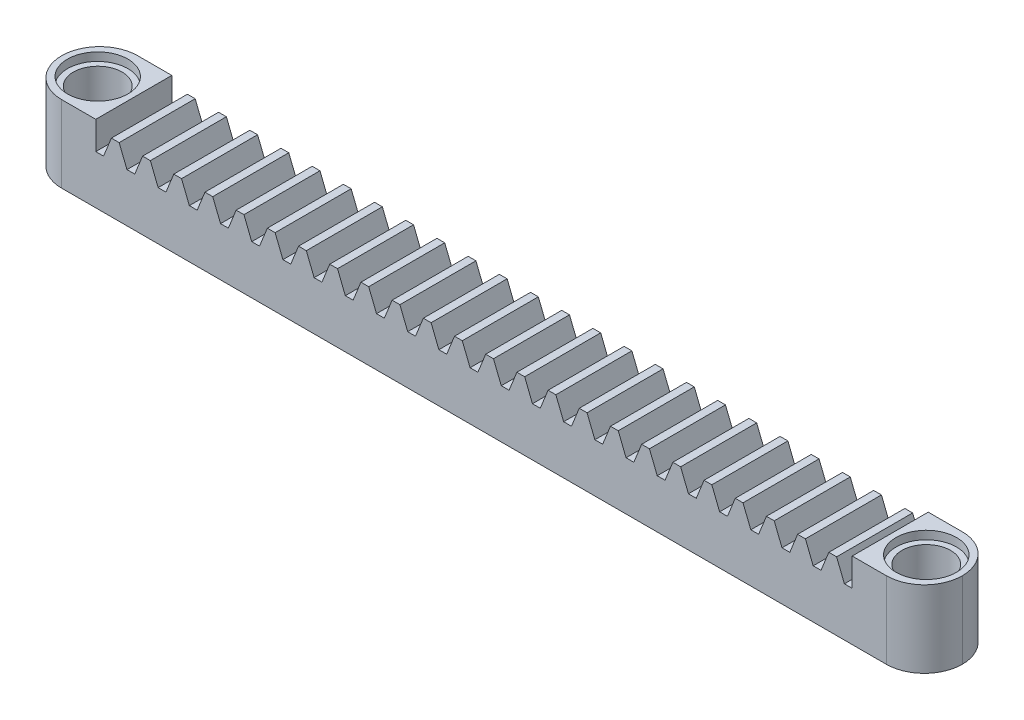
from build123d import *

# Parameters (mm, degrees)
SALIENTE_EXTRUIR1_DEPTH = 7.8
MATRIZL1_DEPTH          = 7.8
CROQUIS2_W              = 7.8
CROQUIS2_H              = 4.999
SALIENTE_EXTRUIR2_DEPTH = 0.801
CROQUIS4_W              = 7.4
CROQUIS4_H              = 7.8
CROQUIS4_R              = 3.1
SALIENTE_EXTRUIR3_DEPTH = 7.87
SALIENTE_EXTRUIR4_START = 0.85
CROQUIS4_3_R            = 3.1
CROQUIS4_3_R_2          = 2.5
SALIENTE_EXTRUIR4_DEPTH = 6.17
REDONDEO2_R             = 3.9


with BuildPart() as part:
    # Croquis1 → Saliente-Extruir1 (new body)
    with BuildSketch(Plane.XY):
        Polygon((0, 0), (3.199966839, 0), (3.199966839, 4.999), (2.398966839, 4.999), (1.598983419, 6.999), (0.799983419, 6.999), (0, 4.999), align=None)
    extrude(amount=SALIENTE_EXTRUIR1_DEPTH)

    # MatrizL1: read off the stored shape, not the designer's step
    # MatrizL1 outline → MatrizL1 (add)
    with BuildSketch(Plane.XY):
        Polygon((0.799983419, 6.999), (0, 4.999), (0, 0), (76.799966839, 0), (76.799966839, 4.999), (75.998966839, 4.999), (75.198983419, 6.999), (74.399983419, 6.999), (73.6, 4.999), (72.798966839, 4.999), (71.998983419, 6.999), (71.199983419, 6.999), (70.4, 4.999), (69.598966839, 4.999), (68.798983419, 6.999), (67.999983419, 6.999), (67.2, 4.999), (66.398966839, 4.999), (65.598983419, 6.999), (64.799983419, 6.999), (64, 4.999), (63.198966839, 4.999), (62.398983419, 6.999), (61.599983419, 6.999), (60.8, 4.999), (59.998966839, 4.999), (59.198983419, 6.999), (58.399983419, 6.999), (57.6, 4.999), (56.798966839, 4.999), (55.998983419, 6.999), (55.199983419, 6.999), (54.4, 4.999), (53.598966839, 4.999), (52.798983419, 6.999), (51.999983419, 6.999), (51.2, 4.999), (50.398966839, 4.999), (49.598983419, 6.999), (48.799983419, 6.999), (48, 4.999), (47.198966839, 4.999), (46.398983419, 6.999), (45.599983419, 6.999), (44.8, 4.999), (43.998966839, 4.999), (43.198983419, 6.999), (42.399983419, 6.999), (41.6, 4.999), (40.798966839, 4.999), (39.998983419, 6.999), (39.199983419, 6.999), (38.4, 4.999), (37.598966839, 4.999), (36.798983419, 6.999), (35.999983419, 6.999), (35.2, 4.999), (34.398966839, 4.999), (33.598983419, 6.999), (32.799983419, 6.999), (32, 4.999), (31.198966839, 4.999), (30.398983419, 6.999), (29.599983419, 6.999), (28.8, 4.999), (27.998966839, 4.999), (27.198983419, 6.999), (26.399983419, 6.999), (25.6, 4.999), (24.798966839, 4.999), (23.998983419, 6.999), (23.199983419, 6.999), (22.4, 4.999), (21.598966839, 4.999), (20.798983419, 6.999), (19.999983419, 6.999), (19.2, 4.999), (18.398966839, 4.999), (17.598983419, 6.999), (16.799983419, 6.999), (16, 4.999), (15.198966839, 4.999), (14.398983419, 6.999), (13.599983419, 6.999), (12.8, 4.999), (11.998966839, 4.999), (11.198983419, 6.999), (10.399983419, 6.999), (9.6, 4.999), (8.798966839, 4.999), (7.998983419, 6.999), (7.199983419, 6.999), (6.4, 4.999), (5.598966839, 4.999), (4.798983419, 6.999), (3.999983419, 6.999), (3.2, 4.999), (2.398966839, 4.999), (1.598983419, 6.999), align=None)
    extrude(amount=MATRIZL1_DEPTH)

    # Croquis2 → Saliente-Extruir2 (add)
    with BuildSketch(Plane.ZY):
        with Locations((3.9, 2.4995)):
            Rectangle(CROQUIS2_W, CROQUIS2_H)
    extrude(amount=SALIENTE_EXTRUIR2_DEPTH)

    # Croquis4 → Saliente-Extruir3 (add)
    # profile 1 of 2: a face of its own
    with BuildSketch(Plane(origin=(0, 0, 0), x_dir=(1, 0, 0), z_dir=(0, 1, 0))):
        with Locations((-4.501, -3.9)):
            Rectangle(CROQUIS4_W, CROQUIS4_H)
        with Locations(Location((-4.501, -3.9, 0), (0, 0, 270))):
            Circle(CROQUIS4_R, mode=Mode.SUBTRACT)
    # profile 2 of 2: a face of its own
    with BuildSketch(Plane(origin=(0, 0, 0), x_dir=(1, 0, 0), z_dir=(0, 1, 0))):
        with Locations((80.499966839, -3.9)):
            Rectangle(CROQUIS4_W, CROQUIS4_H)
        with Locations(Location((80.499966839, -3.9, 0), (0, 0, 270))):
            Circle(CROQUIS4_R, mode=Mode.SUBTRACT)
    extrude(amount=SALIENTE_EXTRUIR3_DEPTH)

    # Croquis4<3> → Saliente-Extruir4 (add)
    # profile 1 of 2: a face of its own
    with BuildSketch(Plane(origin=(0, 0, 0), x_dir=(1, 0, 0), z_dir=(0, 1, 0)).offset(SALIENTE_EXTRUIR4_START)):
        with Locations(Location((-4.501, -3.9, 0), (0, 0, 270))):
            Circle(CROQUIS4_3_R)
        with Locations(Location((-4.501, -3.9, 0), (0, 0, 270))):
            Circle(CROQUIS4_3_R_2, mode=Mode.SUBTRACT)
    # profile 2 of 2: a face of its own
    with BuildSketch(Plane(origin=(0, 0, 0), x_dir=(1, 0, 0), z_dir=(0, 1, 0)).offset(SALIENTE_EXTRUIR4_START)):
        with Locations(Location((80.499966839, -3.9, 0), (0, 0, 270))):
            Circle(CROQUIS4_3_R)
        with Locations(Location((80.499966839, -3.9, 0), (0, 0, 270))):
            Circle(CROQUIS4_3_R_2, mode=Mode.SUBTRACT)
    extrude(amount=SALIENTE_EXTRUIR4_DEPTH)

    # Redondeo2
    redondeo2_edges = [part.edges().sort_by_distance(p)[0] for p in [
        (84.199966839, 3.935, 0),
        (84.199966839, 3.935, 7.8),
        (-8.201, 3.935, 0),
        (-8.201, 3.935, 7.8),
    ]]
    fillet(redondeo2_edges, radius=REDONDEO2_R - 0.0001)  # a hair under: the kernel refuses the full size


solid = part.part
